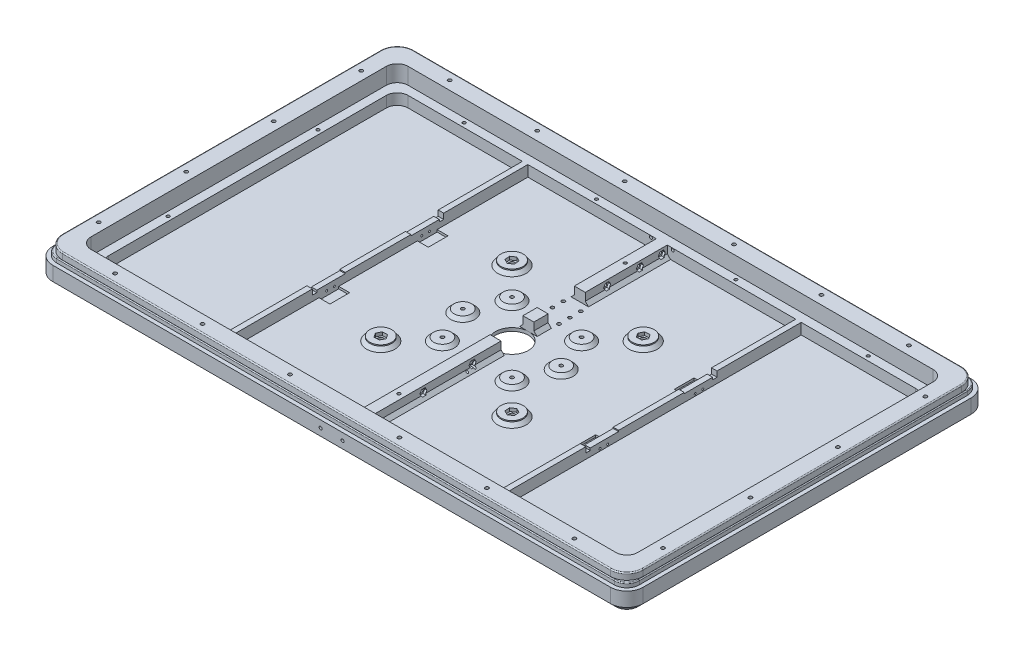
from build123d import *

# Parameters (mm, degrees)
SKETCH1_W                       = 540
SKETCH1_H                       = 330
BOSS_EXTRUDE1_DEPTH             = 3
SKETCH2_W                       = 540
SKETCH2_H                       = 330
SKETCH2_W_2                     = 500
SKETCH2_H_2                     = 290
BOSS_EXTRUDE2_DEPTH             = 25
FILLET1_R                       = 15
SKETCH4_R                       = 1.6
CUT_EXTRUDE1_DEPTH              = 28
SKETCH5_R                       = 15
CUT_EXTRUDE2_DEPTH              = 3
CHAMFER1_SIZE                   = 5
SKETCH7_R                       = 2.6
CUT_EXTRUDE3_DEPTH              = 3
SKETCH9_R                       = 1.6
CUT_EXTRUDE4_DEPTH              = 47
CUT_EXTRUDE5_DEPTH              = 10
FILLET2_R                       = 1
BOSS_EXTRUDE3_DEPTH             = 4
FILLET4_R                       = 0.8
SKETCH23_W                      = 10
SKETCH23_H                      = 130
SKETCH23_W_2                    = 5
SKETCH23_H_2                    = 290
BOSS_EXTRUDE4_DEPTH             = 10
SKETCH24_W                      = 500
SKETCH24_H                      = 290
SKETCH24_W_2                    = 484
SKETCH24_H_2                    = 274
BOSS_EXTRUDE5_DEPTH             = 10
CUT_EXTRUDE6_REACH              = 433.295
SKETCH25_R                      = 0.9
SKETCH26_W                      = 10
SKETCH26_H                      = 18
CUT_EXTRUDE7_DEPTH              = 2
SKETCH27_W                      = 5
SKETCH27_H                      = 30
CUT_EXTRUDE8_DEPTH              = 3
SKETCH28_W                      = 5
SKETCH28_H                      = 60
CUT_EXTRUDE9_DEPTH              = 2
SKETCH29_W                      = 5
SKETCH29_H                      = 4
CUT_EXTRUDE10_DEPTH             = 2
SKETCH31_W                      = 16
SKETCH31_H                      = 34
BOSS_EXTRUDE6_DEPTH             = 53
BOSS_EXTRUDE6_DIRECTION_2_REACH = 318.781
FILLET5_R                       = 15
SKETCH34_R                      = 3
CUT_EXTRUDE11_DEPTH             = 53
SKETCH35_R                      = 8
SKETCH35_R_2                    = 1.6
BOSS_EXTRUDE7_DEPTH             = 3
CHAMFER2_SIZE                   = 3
SKETCH37_W                      = 16
SKETCH37_H                      = 34
CUT_EXTRUDE12_DEPTH             = 63
SKETCH38_R                      = 1.6
SKETCH38_R_2                    = 1.5
CUT_EXTRUDE13_DEPTH             = 90
CHAMFER3_SIZE                   = 3
SKETCH39_R                      = 1.4
CUT_EXTRUDE14_DEPTH             = 8
FILLET6_R                       = 10
FILLET7_R                       = 10
CUT_EXTRUDE15_DEPTH             = 30
CUT_EXTRUDE15_DEPTH_BACK        = 30
SKETCH41_R                      = 5
CUT_EXTRUDE16_DEPTH             = 10
CUT_EXTRUDE16_DEPTH_BACK        = 30
SKETCH42_R                      = 1.6
CUT_EXTRUDE17_DEPTH             = 17
CUT_EXTRUDE17_DEPTH_BACK        = 2
SKETCH45_R                      = 10
SKETCH45_R_2                    = 2.6
BOSS_EXTRUDE8_DEPTH             = 4
CHAMFER4_SIZE                   = 3
CUT_EXTRUDE18_DEPTH             = 3
CUT_EXTRUDE20_REACH             = 429.298
SKETCH52_R                      = 1.35


# Some blends are built 0.0001 mm under size
with BuildPart() as part:
    # Sketch1 → Boss-Extrude1 (new body)
    with BuildSketch(Plane(origin=(0, 0, 0), x_dir=(1, 0, 0), z_dir=(0, 1, 0))):
        Rectangle(SKETCH1_W, SKETCH1_H)
    extrude(amount=BOSS_EXTRUDE1_DEPTH)

    # Sketch2 → Boss-Extrude2 (add)
    with BuildSketch(Plane(origin=(0, 3, 0), x_dir=(1, 0, 0), z_dir=(0, 1, 0))):
        Rectangle(SKETCH2_W, SKETCH2_H)
        Rectangle(SKETCH2_W_2, SKETCH2_H_2, mode=Mode.SUBTRACT)
    extrude(amount=BOSS_EXTRUDE2_DEPTH)

    # Fillet1
    fillet1_edges = [part.edges().sort_by_distance(p)[0] for p in [
        (270, 14, 165),
        (-270, 14, 165),
        (-270, 14, -165),
        (270, 14, -165),
    ]]
    fillet(fillet1_edges, radius=FILLET1_R)

    # Sketch4 → Cut-Extrude1 (cut)
    with BuildSketch(Plane(origin=(0, 28, 0), x_dir=(1, 0, 0), z_dir=(0, 1, 0))):
        with Locations(Location((-258, 120, 0), (0, 0, 270))):
            Circle(SKETCH4_R)
        with Locations(Location((-258, 40, 0), (0, 0, 270))):
            Circle(SKETCH4_R)
        with Locations(Location((-210, 153, 0), (0, 0, 270))):
            Circle(SKETCH4_R)
        with Locations(Location((-130, 153, 0), (0, 0, 270))):
            Circle(SKETCH4_R)
        with Locations(Location((-50, 153, 0), (0, 0, 270))):
            Circle(SKETCH4_R)
        with Locations(Location((50, 153, 0), (0, 0, 90))):
            Circle(SKETCH4_R)
        with Locations(Location((130, 153, 0), (0, 0, 90))):
            Circle(SKETCH4_R)
        with Locations(Location((210, 153, 0), (0, 0, 90))):
            Circle(SKETCH4_R)
        with Locations(Location((258, 40, 0), (0, 0, 90))):
            Circle(SKETCH4_R)
        with Locations(Location((258, 120, 0), (0, 0, 90))):
            Circle(SKETCH4_R)
        with Locations(Location((258, -120, 0), (0, 0, 270))):
            Circle(SKETCH4_R)
        with Locations(Location((258, -40, 0), (0, 0, 270))):
            Circle(SKETCH4_R)
        with Locations(Location((210, -153, 0), (0, 0, 270))):
            Circle(SKETCH4_R)
        with Locations(Location((130, -153, 0), (0, 0, 270))):
            Circle(SKETCH4_R)
        with Locations(Location((50, -153, 0), (0, 0, 270))):
            Circle(SKETCH4_R)
        with Locations(Location((-50, -153, 0), (0, 0, 90))):
            Circle(SKETCH4_R)
        with Locations(Location((-130, -153, 0), (0, 0, 90))):
            Circle(SKETCH4_R)
        with Locations(Location((-210, -153, 0), (0, 0, 90))):
            Circle(SKETCH4_R)
        with Locations(Location((-258, -40, 0), (0, 0, 90))):
            Circle(SKETCH4_R)
        with Locations(Location((-258, -120, 0), (0, 0, 90))):
            Circle(SKETCH4_R)
    extrude(amount=-CUT_EXTRUDE1_DEPTH, mode=Mode.SUBTRACT)

    # Sketch5 → Cut-Extrude2 (cut)
    with BuildSketch(Plane(origin=(0, 3, 0), x_dir=(1, 0, 0), z_dir=(0, 1, 0))):
        with Locations(Location((0, 0, 0), (0, 0, 270))):
            Circle(SKETCH5_R)
    extrude(amount=-CUT_EXTRUDE2_DEPTH, mode=Mode.SUBTRACT)

    # Chamfer1
    chamfer1_edges = [part.edges().sort_by_distance(p)[0] for p in [
        (-270, 0, 0),
        (270, 0, 0),
        (0, 0, 165),
        (0, 0, -165),
        (265.606601718, 0, -160.606601718),
        (265.606601718, 0, 160.606601718),
        (-265.606601718, 0, 160.606601718),
        (-265.606601718, 0, -160.606601718),
    ]]
    chamfer(chamfer1_edges, length=CHAMFER1_SIZE)

    # Sketch7 → Cut-Extrude3 (cut)
    with BuildSketch(Plane.XZ):
        with Locations(Location((-60, 60, 0), (0, 0, 270))):
            Circle(SKETCH7_R)
        with Locations(Location((60, 60, 0), (0, 0, 270))):
            Circle(SKETCH7_R)
        with Locations(Location((60, -60, 0), (0, 0, 270))):
            Circle(SKETCH7_R)
        with Locations(Location((-60, -60, 0), (0, 0, 270))):
            Circle(SKETCH7_R)
    extrude(amount=-CUT_EXTRUDE3_DEPTH, mode=Mode.SUBTRACT)

    # Sketch9 → Cut-Extrude4 (cut)
    with BuildSketch(Plane.XZ):
        with Locations(Location((-31.819805153, 31.819805153, 0), (0, 0, 270))):
            Circle(SKETCH9_R)
        with Locations(Location((31.819805153, 31.819805153, 0), (0, 0, 270))):
            Circle(SKETCH9_R)
        with Locations(Location((31.819805153, -31.819805153, 0), (0, 0, 270))):
            Circle(SKETCH9_R)
        with Locations(Location((-31.819805153, -31.819805153, 0), (0, 0, 270))):
            Circle(SKETCH9_R)
        with Locations(Location((45, 0, 0), (0, 0, 270))):
            Circle(SKETCH9_R)
        with Locations(Location((-45, 0, 0), (0, 0, 270))):
            Circle(SKETCH9_R)
    extrude(amount=-CUT_EXTRUDE4_DEPTH, mode=Mode.SUBTRACT)

    # Sketch19 → Cut-Extrude5 (cut)
    with BuildSketch(Plane(origin=(0, 28, 0), x_dir=(1, 0, 0), z_dir=(0, 1, 0))):
        with BuildLine():
            Line((255, -165), (-255, -165))
            ThreePointArc((-255, -165), (-265.606601718, -160.606601718), (-270, -150))
            Line((-270, -150), (-270, 150))
            ThreePointArc((-270, 150), (-265.606601718, 160.606601718), (-255, 165))
            Line((-255, 165), (255, 165))
            ThreePointArc((255, 165), (265.606601718, 160.606601718), (270, 150))
            Line((270, 150), (270, -150))
            ThreePointArc((270, -150), (265.606601718, -160.606601718), (255, -165))
        make_face()
        with BuildLine():
            Line((250.5, 160.5), (-250.5, 160.5))
            ThreePointArc((-250.5, 160.5), (-261.106601718, 156.106601718), (-265.5, 145.5))
            Line((-265.5, 145.5), (-265.5, -145.5))
            ThreePointArc((-265.5, -145.5), (-261.106601718, -156.106601718), (-250.5, -160.5))
            Line((-250.5, -160.5), (250.5, -160.5))
            ThreePointArc((250.5, -160.5), (261.106601718, -156.106601718), (265.5, -145.5))
            Line((265.5, -145.5), (265.5, 145.5))
            ThreePointArc((265.5, 145.5), (261.106601718, 156.106601718), (250.5, 160.5))
        make_face(mode=Mode.SUBTRACT)
    extrude(amount=-CUT_EXTRUDE5_DEPTH, mode=Mode.SUBTRACT)

    # Fillet2
    fillet2_edges = [part.edges().sort_by_distance(p)[0] for p in [
        (-261.106601718, 28, -156.106601718),
        (0, 28, -160.5),
        (261.106601718, 28, -156.106601718),
        (265.5, 28, 0),
        (261.106601718, 28, 156.106601718),
        (0, 28, 160.5),
        (-261.106601718, 28, 156.106601718),
        (-265.5, 28, 0),
    ]]
    fillet(fillet2_edges, radius=FILLET2_R)

    # Sketch20 → Boss-Extrude3 (add)
    with BuildSketch(Plane(origin=(0, 18, 0), x_dir=(1, 0, 0), z_dir=(0, 1, 0))):
        with BuildLine():
            Line((-255, 161.4), (255, 161.4))
            ThreePointArc((255, 161.4), (263.061017306, 158.061017306), (266.4, 150))
            Line((266.4, 150), (266.4, -150))
            ThreePointArc((266.4, -150), (263.061017306, -158.061017306), (255, -161.4))
            Line((255, -161.4), (-255, -161.4))
            ThreePointArc((-255, -161.4), (-263.061017306, -158.061017306), (-266.4, -150))
            Line((-266.4, -150), (-266.4, 150))
            ThreePointArc((-266.4, 150), (-263.061017306, 158.061017306), (-255, 161.4))
        make_face()
        with BuildLine():
            Line((-255, 157.9), (255, 157.9))
            ThreePointArc((255, 157.9), (260.586143571, 155.586143571), (262.9, 150))
            Line((262.9, 150), (262.9, -150))
            ThreePointArc((262.9, -150), (260.586143571, -155.586143571), (255, -157.9))
            Line((255, -157.9), (-255, -157.9))
            ThreePointArc((-255, -157.9), (-260.586143571, -155.586143571), (-262.9, -150))
            Line((-262.9, -150), (-262.9, 150))
            ThreePointArc((-262.9, 150), (-260.586143571, 155.586143571), (-255, 157.9))
        make_face(mode=Mode.SUBTRACT)
    extrude(amount=BOSS_EXTRUDE3_DEPTH)

    # Fillet4
    fillet4_edges = [part.edges().sort_by_distance(p)[0] for p in [
        (-263.061017306, 22, -158.061017306),
        (-266.4, 22, 0),
        (-263.061017306, 22, 158.061017306),
        (0, 22, 161.4),
        (263.061017306, 22, 158.061017306),
        (266.4, 22, 0),
        (263.061017306, 22, -158.061017306),
        (0, 22, -161.4),
    ]]
    fillet(fillet4_edges, radius=FILLET4_R)

    # Sketch23 → Boss-Extrude4 (add)
    with BuildSketch(Plane(origin=(0, 3, 0), x_dir=(1, 0, 0), z_dir=(0, 1, 0))):
        with Locations((0, 80)):
            Rectangle(SKETCH23_W, SKETCH23_H)
        with Locations((0, -80)):
            Rectangle(SKETCH23_W, SKETCH23_H)
        with Locations((125, 0)):
            Rectangle(SKETCH23_W_2, SKETCH23_H_2)
        with Locations((-125, 0)):
            Rectangle(SKETCH23_W_2, SKETCH23_H_2)
    extrude(amount=BOSS_EXTRUDE4_DEPTH)

    # Sketch24 → Boss-Extrude5 (add)
    with BuildSketch(Plane(origin=(0, 3, 0), x_dir=(1, 0, 0), z_dir=(0, 1, 0))):
        Rectangle(SKETCH24_W, SKETCH24_H)
        Rectangle(SKETCH24_W_2, SKETCH24_H_2, mode=Mode.SUBTRACT)
    extrude(amount=BOSS_EXTRUDE5_DEPTH)

    # Cut-Extrude6: up to this face of the body (flat: up to its plane)
    cut_extrude6_end = Plane(part.part.faces().sort_by_distance((-127.5, 8, 0))[0])
    # Sketch25 → Cut-Extrude6 (cut, up to the picked face)
    with BuildSketch(Plane(origin=(127.5, 0, 0), x_dir=(0, 0, -1), z_dir=(1, 0, 0)), mode=Mode.PRIVATE) as cut_extrude6_sk1:
        with Locations(Location((-47, 5, 0), (0, 0, 180))):
            Circle(SKETCH25_R)
    cut_extrude6_tool1 = split(extrude(cut_extrude6_sk1.sketch, amount=-CUT_EXTRUDE6_REACH, mode=Mode.PRIVATE), bisect_by=cut_extrude6_end, keep=Keep.BOTH, mode=Mode.PRIVATE)
    # Sketch25 → Cut-Extrude6 (cut, up to the picked face)
    with BuildSketch(Plane(origin=(127.5, 0, 0), x_dir=(0, 0, -1), z_dir=(1, 0, 0)), mode=Mode.PRIVATE) as cut_extrude6_sk2:
        with Locations(Location((-40, 5, 0), (0, 0, 180))):
            Circle(SKETCH25_R)
    cut_extrude6_tool2 = split(extrude(cut_extrude6_sk2.sketch, amount=-CUT_EXTRUDE6_REACH, mode=Mode.PRIVATE), bisect_by=cut_extrude6_end, keep=Keep.BOTH, mode=Mode.PRIVATE)
    # Sketch25 → Cut-Extrude6 (cut, up to the picked face)
    with BuildSketch(Plane(origin=(127.5, 0, 0), x_dir=(0, 0, -1), z_dir=(1, 0, 0)), mode=Mode.PRIVATE) as cut_extrude6_sk3:
        with Locations(Location((47, 5, 0), (0, 0, 180))):
            Circle(SKETCH25_R)
    cut_extrude6_tool3 = split(extrude(cut_extrude6_sk3.sketch, amount=-CUT_EXTRUDE6_REACH, mode=Mode.PRIVATE), bisect_by=cut_extrude6_end, keep=Keep.BOTH, mode=Mode.PRIVATE)
    # Sketch25 → Cut-Extrude6 (cut, up to the picked face)
    with BuildSketch(Plane(origin=(127.5, 0, 0), x_dir=(0, 0, -1), z_dir=(1, 0, 0)), mode=Mode.PRIVATE) as cut_extrude6_sk4:
        with Locations(Location((40, 5, 0), (0, 0, 180))):
            Circle(SKETCH25_R)
    cut_extrude6_tool4 = split(extrude(cut_extrude6_sk4.sketch, amount=-CUT_EXTRUDE6_REACH, mode=Mode.PRIVATE), bisect_by=cut_extrude6_end, keep=Keep.BOTH, mode=Mode.PRIVATE)
    add(cut_extrude6_tool1.solids().sort_by(Axis((127.5, 5, 47), (-1, 0, 0)))[0], mode=Mode.SUBTRACT)
    add(cut_extrude6_tool2.solids().sort_by(Axis((127.5, 5, 40), (-1, 0, 0)))[0], mode=Mode.SUBTRACT)
    add(cut_extrude6_tool3.solids().sort_by(Axis((127.5, 5, -47), (-1, 0, 0)))[0], mode=Mode.SUBTRACT)
    add(cut_extrude6_tool4.solids().sort_by(Axis((127.5, 5, -40), (-1, 0, 0)))[0], mode=Mode.SUBTRACT)

    # Sketch26 → Cut-Extrude7 (cut)
    with BuildSketch(Plane(origin=(0, 3, 0), x_dir=(1, 0, 0), z_dir=(0, 1, 0))):
        with Locations((-117.5, -45)):
            Rectangle(SKETCH26_W, SKETCH26_H)
        with Locations((-117.5, 45)):
            Rectangle(SKETCH26_W, SKETCH26_H)
        with Locations((117.5, -45)):
            Rectangle(SKETCH26_W, SKETCH26_H)
        with Locations((117.5, 45)):
            Rectangle(SKETCH26_W, SKETCH26_H)
    extrude(amount=-CUT_EXTRUDE7_DEPTH, mode=Mode.SUBTRACT)

    # Sketch27 → Cut-Extrude8 (cut)
    with BuildSketch(Plane(origin=(0, 13, 0), x_dir=(1, 0, 0), z_dir=(0, 1, 0))):
        with Locations((-125, -45)):
            Rectangle(SKETCH27_W, SKETCH27_H)
        with Locations((-125, 45)):
            Rectangle(SKETCH27_W, SKETCH27_H)
        with Locations((125, 45)):
            Rectangle(SKETCH27_W, SKETCH27_H)
        with Locations((125, -45)):
            Rectangle(SKETCH27_W, SKETCH27_H)
    extrude(amount=-CUT_EXTRUDE8_DEPTH, mode=Mode.SUBTRACT)

    # Sketch28 → Cut-Extrude9 (cut)
    with BuildSketch(Plane(origin=(0, 13, 0), x_dir=(1, 0, 0), z_dir=(0, 1, 0))):
        with Locations((-125, 0)):
            Rectangle(SKETCH28_W, SKETCH28_H)
        with Locations((125, 0)):
            Rectangle(SKETCH28_W, SKETCH28_H)
    extrude(amount=-CUT_EXTRUDE9_DEPTH, mode=Mode.SUBTRACT)

    # Sketch29 → Cut-Extrude10 (cut)
    with BuildSketch(Plane(origin=(0, 10, 0), x_dir=(1, 0, 0), z_dir=(0, 1, 0))):
        with Locations((-125, 58)):
            Rectangle(SKETCH29_W, SKETCH29_H)
        with Locations((-125, -58)):
            Rectangle(SKETCH29_W, SKETCH29_H)
        with Locations((125, -58)):
            Rectangle(SKETCH29_W, SKETCH29_H)
        with Locations((125, 58)):
            Rectangle(SKETCH29_W, SKETCH29_H)
    extrude(amount=-CUT_EXTRUDE10_DEPTH, mode=Mode.SUBTRACT)

    # Sketch31 → Boss-Extrude6 (add)
    with BuildSketch(Plane(origin=(0, 13, 0), x_dir=(1, 0, 0), z_dir=(0, 1, 0))):
        with Locations((0, 45)):
            Rectangle(SKETCH31_W, SKETCH31_H)
    extrude(amount=BOSS_EXTRUDE6_DEPTH)

    # Boss-Extrude6 direction 2: up to this face of the body (flat: up to its plane)
    boss_extrude6_direction_2_end = Plane(part.part.faces().sort_by_distance((-63.514526325, 3, 0))[0])
    # Sketch31 → Boss-Extrude6 direction 2 (add, up to the picked face)
    with BuildSketch(Plane(origin=(0, 13, 0), x_dir=(1, 0, 0), z_dir=(0, 1, 0)), mode=Mode.PRIVATE) as boss_extrude6_direction_2_sk1:
        with Locations((0, 45)):
            Rectangle(SKETCH31_W, SKETCH31_H)
    boss_extrude6_direction_2_tool1 = split(extrude(boss_extrude6_direction_2_sk1.sketch, amount=-BOSS_EXTRUDE6_DIRECTION_2_REACH, mode=Mode.PRIVATE), bisect_by=boss_extrude6_direction_2_end, keep=Keep.BOTH, mode=Mode.PRIVATE)
    add(boss_extrude6_direction_2_tool1.solids().sort_by(Axis((0, 13, -45), (0, -1, 0)))[0])

    # Fillet5
    fillet5_edges = [part.edges().sort_by_distance(p)[0] for p in [
        (0, 66, -62),
        (0, 66, -28),
    ]]
    fillet(fillet5_edges, radius=FILLET5_R)

    # Sketch34 → Cut-Extrude11 (cut)
    with BuildSketch(Plane.ZY.offset(8)):
        with Locations((-45, 53)):
            Circle(SKETCH34_R)
    extrude(amount=-CUT_EXTRUDE11_DEPTH, mode=Mode.SUBTRACT)

    # Sketch35 → Boss-Extrude7 (add)
    # profile 1 of 6: a face of its own
    with BuildSketch(Plane(origin=(0, 3, 0), x_dir=(1, 0, 0), z_dir=(0, 1, 0))):
        with Locations(Location((-31.819805153, 31.819805153, 0), (0, 0, 90))):
            Circle(SKETCH35_R)
        with Locations(Location((-31.819805153, 31.819805153, 0), (0, 0, 90))):
            Circle(SKETCH35_R_2, mode=Mode.SUBTRACT)
    # profile 2 of 6: a face of its own
    with BuildSketch(Plane(origin=(0, 3, 0), x_dir=(1, 0, 0), z_dir=(0, 1, 0))):
        with Locations(Location((31.819805153, 31.819805153, 0), (0, 0, 90))):
            Circle(SKETCH35_R)
        with Locations(Location((31.819805153, 31.819805153, 0), (0, 0, 90))):
            Circle(SKETCH35_R_2, mode=Mode.SUBTRACT)
    # profile 3 of 6: a face of its own
    with BuildSketch(Plane(origin=(0, 3, 0), x_dir=(1, 0, 0), z_dir=(0, 1, 0))):
        with Locations(Location((31.819805153, -31.819805153, 0), (0, 0, 90))):
            Circle(SKETCH35_R)
        with Locations(Location((31.819805153, -31.819805153, 0), (0, 0, 90))):
            Circle(SKETCH35_R_2, mode=Mode.SUBTRACT)
    # profile 4 of 6: a face of its own
    with BuildSketch(Plane(origin=(0, 3, 0), x_dir=(1, 0, 0), z_dir=(0, 1, 0))):
        with Locations(Location((-31.819805153, -31.819805153, 0), (0, 0, 90))):
            Circle(SKETCH35_R)
        with Locations(Location((-31.819805153, -31.819805153, 0), (0, 0, 90))):
            Circle(SKETCH35_R_2, mode=Mode.SUBTRACT)
    # profile 5 of 6: a face of its own
    with BuildSketch(Plane(origin=(0, 3, 0), x_dir=(1, 0, 0), z_dir=(0, 1, 0))):
        with Locations(Location((-45, 0, 0), (0, 0, 90))):
            Circle(SKETCH35_R)
        with Locations(Location((-45, 0, 0), (0, 0, 270))):
            Circle(SKETCH35_R_2, mode=Mode.SUBTRACT)
    # profile 6 of 6: a face of its own
    with BuildSketch(Plane(origin=(0, 3, 0), x_dir=(1, 0, 0), z_dir=(0, 1, 0))):
        with Locations(Location((45, 0, 0), (0, 0, 90))):
            Circle(SKETCH35_R)
        with Locations(Location((45, 0, 0), (0, 0, 90))):
            Circle(SKETCH35_R_2, mode=Mode.SUBTRACT)
    extrude(amount=BOSS_EXTRUDE7_DEPTH)

    # Chamfer2
    chamfer2_edges = [part.edges().sort_by_distance(p)[0] for p in [
        (-31.819805153, 3, -23.819805153),
        (-45, 3, 8),
        (31.819805153, 3, -23.819805153),
        (31.819805153, 3, 39.819805153),
        (-31.819805153, 3, 39.819805153),
        (45, 3, 8),
    ]]
    chamfer(chamfer2_edges, length=CHAMFER2_SIZE - 0.0001)  # a hair under: the kernel refuses the full size

    # Sketch37 → Cut-Extrude12 (cut)
    with BuildSketch(Plane(origin=(0, 66, 0), x_dir=(1, 0, 0), z_dir=(0, 1, 0))):
        with Locations((0, 45)):
            Rectangle(SKETCH37_W, SKETCH37_H)
    extrude(amount=-CUT_EXTRUDE12_DEPTH, mode=Mode.SUBTRACT)

    # Sketch38 → Cut-Extrude13 (cut)
    with BuildSketch(Plane(origin=(0, 3, 0), x_dir=(1, 0, 0), z_dir=(0, 1, 0))):
        with Locations(Location((8, 55, 0), (0, 0, 270))):
            Circle(SKETCH38_R)
        with Locations(Location((8, 35, 0), (0, 0, 270))):
            Circle(SKETCH38_R)
        with Locations(Location((-8, 35, 0), (0, 0, 270))):
            Circle(SKETCH38_R)
        with Locations(Location((-8, 55, 0), (0, 0, 270))):
            Circle(SKETCH38_R)
        with Locations(Location((8, 45, 0), (0, 0, 270))):
            Circle(SKETCH38_R_2)
        with Locations(Location((-8, 45, 0), (0, 0, 270))):
            Circle(SKETCH38_R_2)
    extrude(amount=-CUT_EXTRUDE13_DEPTH, mode=Mode.SUBTRACT)

    # Chamfer3
    # the kernel refuses this chamfer: 3 mm, written as the material it adds along each edge
    with BuildSketch(Plane(origin=(5, 3, -15), x_dir=(0.9996219169112969, -0.027495876610586348, 0), z_dir=(0, 0, -1)), Plane(origin=(-5, 3, -28), x_dir=(-0.9996219169112968, -0.027495876610586358, 0), z_dir=(0, 0, 1))) as chamfer3_piece_1:
        Polygon((CHAMFER3_SIZE * 0.999621916911, -CHAMFER3_SIZE * 0.0274958766106), (-CHAMFER3_SIZE * 0.0274958766106, -CHAMFER3_SIZE * 0.999621916911), (0, 0), align=None)
    extrude(amount=13)
    with BuildSketch(Plane(origin=(5, 3, 144.715048964), x_dir=(0.9996219169112969, -0.027495876610586348, 0), z_dir=(0, 0, -1))) as chamfer3_piece_2_section:
        Polygon((CHAMFER3_SIZE * 0.999621916911, -CHAMFER3_SIZE * 0.0274958766106), (-CHAMFER3_SIZE * 0.0274958766106, -CHAMFER3_SIZE * 0.999621916911), (0, 0), align=None)
    chamfer3_piece_2 = extrude(amount=129.715048964, mode=Mode.PRIVATE)
    chamfer3_piece_2 = chamfer3_piece_2 - Plane(origin=(5.98938088, 5, 47), x_dir=(0, 0, 1), z_dir=(1, 0, 0)) * Cylinder(0.9, 272, mode=Mode.PRIVATE)
    chamfer3_piece_2 = chamfer3_piece_2 - Plane(origin=(5.98938088, 5, 40), x_dir=(0, 0, 1), z_dir=(1, 0, 0)) * Cylinder(0.9, 272, mode=Mode.PRIVATE)
    add(chamfer3_piece_2)
    with BuildSketch(Plane(origin=(-5, 3, 15), x_dir=(-0.9996219169112968, -0.027495876610586358, 0), z_dir=(0, 0, 1))) as chamfer3_piece_3_section:
        Polygon((CHAMFER3_SIZE * 0.999621916911, -CHAMFER3_SIZE * 0.0274958766106), (-CHAMFER3_SIZE * 0.0274958766106, -CHAMFER3_SIZE * 0.999621916911), (0, 0), align=None)
    chamfer3_piece_3 = extrude(amount=129.715048964, mode=Mode.PRIVATE)
    chamfer3_piece_3 = chamfer3_piece_3 - Plane(origin=(-5.993381488, 5, 47), x_dir=(0, 0, 1), z_dir=(1, 0, 0)) * Cylinder(0.9, 272, mode=Mode.PRIVATE)
    chamfer3_piece_3 = chamfer3_piece_3 - Plane(origin=(-5.993381488, 5, 40), x_dir=(0, 0, 1), z_dir=(1, 0, 0)) * Cylinder(0.9, 272, mode=Mode.PRIVATE)
    add(chamfer3_piece_3)
    with BuildSketch(Plane(origin=(5, 3, -62), x_dir=(0.9996219169112969, -0.027495876610586348, 0), z_dir=(0, 0, -1)), Plane(origin=(-5, 3, -144.715048964), x_dir=(-0.9996219169112968, -0.027495876610586358, 0), z_dir=(0, 0, 1))) as chamfer3_piece_4:
        Polygon((CHAMFER3_SIZE * 0.999621916911, -CHAMFER3_SIZE * 0.0274958766106), (-CHAMFER3_SIZE * 0.0274958766106, -CHAMFER3_SIZE * 0.999621916911), (0, 0), align=None)
    extrude(amount=82.715048964)

    # Sketch39 → Cut-Extrude14 (cut)
    with BuildSketch(Plane(origin=(0, 13, 0), x_dir=(1, 0, 0), z_dir=(0, 1, 0))):
        with Locations(Location((-246, 68.5, 0), (0, 0, 270))):
            Circle(SKETCH39_R)
        with Locations(Location((-184.75, 141, 0), (0, 0, 270))):
            Circle(SKETCH39_R)
        with Locations(Location((-63.75, 141, 0), (0, 0, 270))):
            Circle(SKETCH39_R)
        with Locations(Location((63.75, 141, 0), (0, 0, 90))):
            Circle(SKETCH39_R)
        with Locations(Location((184.75, 141, 0), (0, 0, 90))):
            Circle(SKETCH39_R)
        with Locations(Location((246, 68.5, 0), (0, 0, 90))):
            Circle(SKETCH39_R)
        with Locations(Location((0, 103.5, 0), (0, 0, 270))):
            Circle(SKETCH39_R)
        with Locations(Location((0, -103.5, 0), (0, 0, 90))):
            Circle(SKETCH39_R)
        with Locations(Location((246, -68.5, 0), (0, 0, 270))):
            Circle(SKETCH39_R)
        with Locations(Location((184.75, -141, 0), (0, 0, 270))):
            Circle(SKETCH39_R)
        with Locations(Location((63.75, -141, 0), (0, 0, 270))):
            Circle(SKETCH39_R)
        with Locations(Location((-63.75, -141, 0), (0, 0, 90))):
            Circle(SKETCH39_R)
        with Locations(Location((-184.75, -141, 0), (0, 0, 90))):
            Circle(SKETCH39_R)
        with Locations(Location((-246, -68.5, 0), (0, 0, 90))):
            Circle(SKETCH39_R)
    extrude(amount=-CUT_EXTRUDE14_DEPTH, mode=Mode.SUBTRACT)

    # Fillet6
    fillet6_edges = [part.edges().sort_by_distance(p)[0] for p in [
        (242, 8, 137),
        (-242, 8, -137),
        (242, 8, -137),
        (-242, 8, 137),
    ]]
    fillet(fillet6_edges, radius=FILLET6_R)

    # Fillet7
    fillet7_edges = [part.edges().sort_by_distance(p)[0] for p in [
        (250, 20.5, -145),
        (-250, 20.5, -145),
        (-250, 20.5, 145),
        (250, 20.5, 145),
    ]]
    fillet(fillet7_edges, radius=FILLET7_R)

    # Sketch41 → Cut-Extrude15 (cut, two sides: drawn at the far end of the back side and taken through both)
    with BuildSketch(Plane(origin=(0, 0, 0), x_dir=(0, 0, -1), z_dir=(1, 0, 0)).offset(-CUT_EXTRUDE15_DEPTH_BACK)):
        with Locations((153, 11.5)):
            Circle(SKETCH41_R)
        with Locations(Location((-153, 11.5, 0), (0, 0, 180))):
            Circle(SKETCH41_R)
    extrude(amount=CUT_EXTRUDE15_DEPTH + CUT_EXTRUDE15_DEPTH_BACK, mode=Mode.SUBTRACT)

    # Sketch42 → Cut-Extrude16 (cut, two sides: drawn at the far end of the back side and taken through both)
    with BuildSketch(Plane(origin=(5, 0, 0), x_dir=(0, 0, -1), z_dir=(1, 0, 0)).offset(-CUT_EXTRUDE16_DEPTH_BACK)):
        with Locations(Location((112, 8, 0), (0, 0, 180))):
            Circle(SKETCH42_R)
        with Locations(Location((132, 8, 0), (0, 0, 180))):
            Circle(SKETCH42_R)
        with Locations(Location((82, 8, 0), (0, 0, 180))):
            Circle(SKETCH42_R)
        with Locations(Location((-86, 8, 0), (0, 0, 180))):
            Circle(SKETCH42_R)
        with Locations(Location((-132, 8, 0), (0, 0, 180))):
            Circle(SKETCH42_R)
        with Locations(Location((-41.05, 8, 0), (0, 0, 180))):
            Circle(SKETCH42_R)
    extrude(amount=CUT_EXTRUDE16_DEPTH + CUT_EXTRUDE16_DEPTH_BACK, mode=Mode.SUBTRACT)

    # Sketch43 → Cut-Extrude17 (cut, two sides: drawn at the far end of the back side and taken through both)
    with BuildSketch(Plane(origin=(5, 0, 0), x_dir=(0, 0, -1), z_dir=(1, 0, 0)).offset(-CUT_EXTRUDE17_DEPTH_BACK)):
        Polygon((-87.616580754, 10.8), (-89.233161507, 8), (-87.616580754, 5.2), (-84.383419246, 5.2), (-82.766838493, 8), (-84.383419246, 10.8), align=None)
        Polygon((-128.766838493, 8), (-130.383419246, 10.8), (-133.616580754, 10.8), (-135.233161507, 8), (-133.616580754, 5.2), (-130.383419246, 5.2), align=None)
        Polygon((-37.816838493, 8), (-39.433419246, 10.8), (-42.666580754, 10.8), (-44.283161507, 8), (-42.666580754, 5.2), (-39.433419246, 5.2), align=None)
        Polygon((85.233161507, 8), (83.616580754, 10.8), (80.383419246, 10.8), (78.766838493, 8), (80.383419246, 5.2), (83.616580754, 5.2), align=None)
        Polygon((115.233161507, 8), (113.616580754, 10.8), (110.383419246, 10.8), (108.766838493, 8), (110.383419246, 5.2), (113.616580754, 5.2), align=None)
        Polygon((130.383419246, 10.8), (128.766838493, 8), (130.383419246, 5.2), (133.616580754, 5.2), (135.233161507, 8), (133.616580754, 10.8), align=None)
    extrude(amount=CUT_EXTRUDE17_DEPTH + CUT_EXTRUDE17_DEPTH_BACK, mode=Mode.SUBTRACT)

    # Sketch45 → Boss-Extrude8 (add)
    # profile 1 of 4: a face of its own
    with BuildSketch(Plane(origin=(0, 3, 0), x_dir=(1, 0, 0), z_dir=(0, 1, 0))):
        with Locations(Location((-60, 60, 0), (0, 0, 90))):
            Circle(SKETCH45_R)
        with Locations(Location((-60, 60, 0), (0, 0, 90))):
            Circle(SKETCH45_R_2, mode=Mode.SUBTRACT)
    # profile 2 of 4: a face of its own
    with BuildSketch(Plane(origin=(0, 3, 0), x_dir=(1, 0, 0), z_dir=(0, 1, 0))):
        with Locations(Location((60, 60, 0), (0, 0, 90))):
            Circle(SKETCH45_R)
        with Locations(Location((60, 60, 0), (0, 0, 90))):
            Circle(SKETCH45_R_2, mode=Mode.SUBTRACT)
    # profile 3 of 4: a face of its own
    with BuildSketch(Plane(origin=(0, 3, 0), x_dir=(1, 0, 0), z_dir=(0, 1, 0))):
        with Locations(Location((60, -60, 0), (0, 0, 90))):
            Circle(SKETCH45_R)
        with Locations(Location((60, -60, 0), (0, 0, 90))):
            Circle(SKETCH45_R_2, mode=Mode.SUBTRACT)
    # profile 4 of 4: a face of its own
    with BuildSketch(Plane(origin=(0, 3, 0), x_dir=(1, 0, 0), z_dir=(0, 1, 0))):
        with Locations(Location((-60, -60, 0), (0, 0, 90))):
            Circle(SKETCH45_R)
        with Locations(Location((-60, -60, 0), (0, 0, 90))):
            Circle(SKETCH45_R_2, mode=Mode.SUBTRACT)
    extrude(amount=BOSS_EXTRUDE8_DEPTH)

    # Chamfer4
    chamfer4_edges = [part.edges().sort_by_distance(p)[0] for p in [
        (-60, 3, -50),
        (60, 3, -50),
        (60, 3, 70),
        (-60, 3, 70),
    ]]
    chamfer(chamfer4_edges, length=CHAMFER4_SIZE)

    # Sketch48 → Cut-Extrude18 (cut)
    with BuildSketch(Plane(origin=(0, 7, 0), x_dir=(1, 0, 0), z_dir=(0, 1, 0))):
        Polygon((62.567013443, 56.090979409), (64.668817858, 60.268588558), (62.101804414, 64.177609149), (57.432986557, 63.909020591), (55.331182143, 59.731411442), (57.898195586, 55.822390851), align=None)
        Polygon((-56.090979409, 62.567013443), (-60.268588558, 64.668817857), (-64.177609149, 62.101804414), (-63.909020591, 57.432986557), (-59.731411442, 55.331182143), (-55.822390851, 57.898195586), align=None)
        Polygon((56.090979409, -62.567013443), (60.268588558, -64.668817857), (64.177609149, -62.101804414), (63.909020591, -57.432986557), (59.731411442, -55.331182143), (55.822390851, -57.898195586), align=None)
        Polygon((-62.567013443, -56.090979409), (-64.668817857, -60.268588558), (-62.101804414, -64.177609149), (-57.432986557, -63.909020591), (-55.331182143, -59.731411442), (-57.898195586, -55.822390851), align=None)
    extrude(amount=-CUT_EXTRUDE18_DEPTH, mode=Mode.SUBTRACT)

    # Cut-Extrude20: up to this face of the body (flat: up to its plane)
    cut_extrude20_end = Plane(part.part.faces().sort_by_distance((0, 11.5, -165))[0])
    # Sketch52 → Cut-Extrude20 (cut, up to the picked face)
    with BuildSketch(Plane.XY.offset(165), mode=Mode.PRIVATE) as cut_extrude20_sk1:
        with Locations((-10, 11.5)):
            Circle(SKETCH52_R)
    cut_extrude20_tool1 = split(extrude(cut_extrude20_sk1.sketch, amount=-CUT_EXTRUDE20_REACH, mode=Mode.PRIVATE), bisect_by=cut_extrude20_end, keep=Keep.BOTH, mode=Mode.PRIVATE)
    # Sketch52 → Cut-Extrude20 (cut, up to the picked face)
    with BuildSketch(Plane.XY.offset(165), mode=Mode.PRIVATE) as cut_extrude20_sk2:
        with Locations((10, 11.5)):
            Circle(SKETCH52_R)
    cut_extrude20_tool2 = split(extrude(cut_extrude20_sk2.sketch, amount=-CUT_EXTRUDE20_REACH, mode=Mode.PRIVATE), bisect_by=cut_extrude20_end, keep=Keep.BOTH, mode=Mode.PRIVATE)
    add(cut_extrude20_tool1.solids().sort_by(Axis((-10, 11.5, 165), (0, 0, -1)))[0], mode=Mode.SUBTRACT)
    add(cut_extrude20_tool2.solids().sort_by(Axis((10, 11.5, 165), (0, 0, -1)))[0], mode=Mode.SUBTRACT)


solid = part.part
